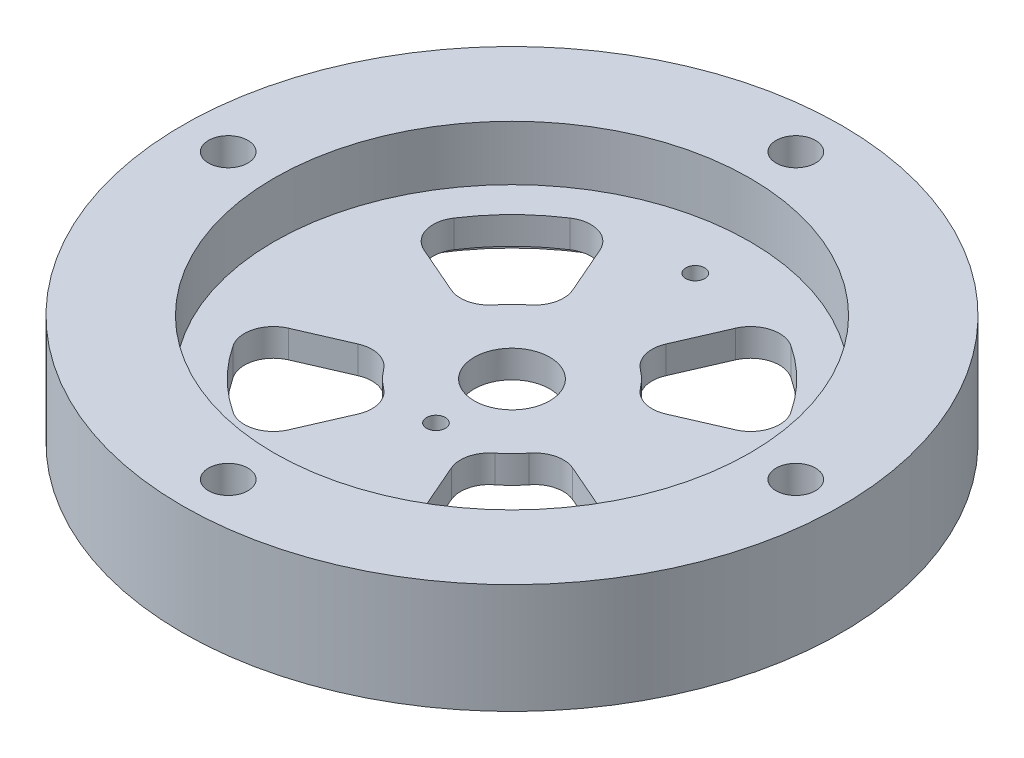
from build123d import *

# Parameters (mm, degrees)
CUT_EXTRUDE1_REACH                                = 53.264
F_18_0_1695_DIAMETER_HOLE1_D                      = 4.3053
F_18_0_1695_DIAMETER_HOLE1_DEPTH                  = 381
F_18_0_1695_DIAMETER_HOLE1_TIP                    = 1.293442612
CUT_EXTRUDE2_REACH                                = 53.264
SKETCH5_R                                         = 4.1275
CSK_FOR_1_FLAT_HEAD_MACHINE_SCREW_100_D           = 2.0574
CSK_FOR_1_FLAT_HEAD_MACHINE_SCREW_100_DEPTH       = 3
CSK_FOR_1_FLAT_HEAD_MACHINE_SCREW_100_CSINK_D     = 3.7084
CSK_FOR_1_FLAT_HEAD_MACHINE_SCREW_100_CSINK_ANGLE = 100
CSK_FOR_1_FLAT_HEAD_MACHINE_SCREW_100_TIP         = 0.618105319


with BuildPart() as part:
    # Sketch1 → Revolve1 (revolve)
    with BuildSketch(Plane.XY):
        Polygon((0, 3), (26, 3), (26, 0), (36, 0), (36, 12), (26, 12), (26, 6), (0, 6), align=None)
    revolve(axis=Axis((0, 0, 0), (0, 1, 0)))

    # Sketch2 → Cut-Extrude1 (cut, up to next)
    with BuildSketch(Plane(origin=(0, 6, 0), x_dir=(1, 0, 0), z_dir=(0, 1, 0)), mode=Mode.PRIVATE) as cut_extrude1_sk1:
        with BuildLine():
            Line((7.398917645, 17.016345603), (5.098689446, 11.726182923))
            ThreePointArc((5.098689446, 11.726182923), (4.936869827, 9.663717077), (6.079965983, 7.939396303))
            ThreePointArc((6.079965983, 7.939396303), (7.071067812, 7.071067812), (7.939396303, 6.079965983))
            ThreePointArc((7.939396303, 6.079965983), (9.663717077, 4.936869827), (11.726182923, 5.098689446))
            Line((11.726182923, 5.098689446), (17.016345603, 7.398917645))
            ThreePointArc((17.016345603, 7.398917645), (18.792276888, 9.401129193), (18.406745328, 12.049552955))
            ThreePointArc((18.406745328, 12.049552955), (15.556349186, 15.556349186), (12.049552955, 18.406745328))
            ThreePointArc((12.049552955, 18.406745328), (9.401129193, 18.792276888), (7.398917645, 17.016345603))
        make_face()
    cut_extrude1_tool1 = extrude(cut_extrude1_sk1.sketch, amount=-CUT_EXTRUDE1_REACH, mode=Mode.PRIVATE) & part.part
    # Sketch2 → Cut-Extrude1 (cut, up to next)
    with BuildSketch(Plane(origin=(0, 6, 0), x_dir=(1, 0, 0), z_dir=(0, 1, 0)), mode=Mode.PRIVATE) as cut_extrude1_sk2:
        with BuildLine():
            Line((-7.398917645, 17.016345603), (-5.098689446, 11.726182923))
            ThreePointArc((-5.098689446, 11.726182923), (-4.936869827, 9.663717077), (-6.079965983, 7.939396303))
            ThreePointArc((-6.079965983, 7.939396303), (-7.071067812, 7.071067812), (-7.939396303, 6.079965983))
            ThreePointArc((-7.939396303, 6.079965983), (-9.663717077, 4.936869827), (-11.726182923, 5.098689446))
            Line((-11.726182923, 5.098689446), (-17.016345603, 7.398917645))
            ThreePointArc((-17.016345603, 7.398917645), (-18.792276888, 9.401129193), (-18.406745328, 12.049552955))
            ThreePointArc((-18.406745328, 12.049552955), (-15.556349186, 15.556349186), (-12.049552955, 18.406745328))
            ThreePointArc((-12.049552955, 18.406745328), (-9.401129193, 18.792276888), (-7.398917645, 17.016345603))
        make_face()
    cut_extrude1_tool2 = extrude(cut_extrude1_sk2.sketch, amount=-CUT_EXTRUDE1_REACH, mode=Mode.PRIVATE) & part.part
    # Sketch2 → Cut-Extrude1 (cut, up to next)
    with BuildSketch(Plane(origin=(0, 6, 0), x_dir=(1, 0, 0), z_dir=(0, 1, 0)), mode=Mode.PRIVATE) as cut_extrude1_sk3:
        with BuildLine():
            Line((17.016345603, -7.398917645), (11.726182923, -5.098689446))
            ThreePointArc((11.726182923, -5.098689446), (9.663717077, -4.936869827), (7.939396303, -6.079965983))
            ThreePointArc((7.939396303, -6.079965983), (7.071067812, -7.071067812), (6.079965983, -7.939396303))
            ThreePointArc((6.079965983, -7.939396303), (4.936869827, -9.663717077), (5.098689446, -11.726182923))
            Line((5.098689446, -11.726182923), (7.398917645, -17.016345603))
            ThreePointArc((7.398917645, -17.016345603), (9.401129193, -18.792276888), (12.049552955, -18.406745328))
            ThreePointArc((12.049552955, -18.406745328), (15.556349186, -15.556349186), (18.406745328, -12.049552955))
            ThreePointArc((18.406745328, -12.049552955), (18.792276888, -9.401129193), (17.016345603, -7.398917645))
        make_face()
    cut_extrude1_tool3 = extrude(cut_extrude1_sk3.sketch, amount=-CUT_EXTRUDE1_REACH, mode=Mode.PRIVATE) & part.part
    # Sketch2 → Cut-Extrude1 (cut, up to next)
    with BuildSketch(Plane(origin=(0, 6, 0), x_dir=(1, 0, 0), z_dir=(0, 1, 0)), mode=Mode.PRIVATE) as cut_extrude1_sk4:
        with BuildLine():
            Line((-7.398917645, -17.016345603), (-5.098689446, -11.726182923))
            ThreePointArc((-5.098689446, -11.726182923), (-4.936869827, -9.663717077), (-6.079965983, -7.939396303))
            ThreePointArc((-6.079965983, -7.939396303), (-7.071067812, -7.071067812), (-7.939396303, -6.079965983))
            ThreePointArc((-7.939396303, -6.079965983), (-9.663717077, -4.936869827), (-11.726182923, -5.098689446))
            Line((-11.726182923, -5.098689446), (-17.016345603, -7.398917645))
            ThreePointArc((-17.016345603, -7.398917645), (-18.792276888, -9.401129193), (-18.406745328, -12.049552955))
            ThreePointArc((-18.406745328, -12.049552955), (-15.556349186, -15.556349186), (-12.049552955, -18.406745328))
            ThreePointArc((-12.049552955, -18.406745328), (-9.401129193, -18.792276888), (-7.398917645, -17.016345603))
        make_face()
    cut_extrude1_tool4 = extrude(cut_extrude1_sk4.sketch, amount=-CUT_EXTRUDE1_REACH, mode=Mode.PRIVATE) & part.part
    add(cut_extrude1_tool1.solids().sort_by_distance((11.555905, 6, -11.555905))[0], mode=Mode.SUBTRACT)
    add(cut_extrude1_tool2.solids().sort_by_distance((-11.555905, 6, -11.555905))[0], mode=Mode.SUBTRACT)
    add(cut_extrude1_tool3.solids().sort_by_distance((11.555905, 6, 11.555905))[0], mode=Mode.SUBTRACT)
    add(cut_extrude1_tool4.solids().sort_by_distance((-11.555905, 6, 11.555905))[0], mode=Mode.SUBTRACT)

    # #18 (0.1695) Diameter Hole1
    with Locations(Plane(origin=(0, 12, 0), x_dir=(1, 0, 0), z_dir=(0, 1, 0))):
        with Locations((0, 31), (0, -31), (-31, 0), (31, 0)):
            Hole(F_18_0_1695_DIAMETER_HOLE1_D / 2, depth=F_18_0_1695_DIAMETER_HOLE1_DEPTH)
            with Locations((0, 0, -(F_18_0_1695_DIAMETER_HOLE1_DEPTH + F_18_0_1695_DIAMETER_HOLE1_TIP / 2))):  # 118° drill point
                Cone(0, F_18_0_1695_DIAMETER_HOLE1_D / 2, F_18_0_1695_DIAMETER_HOLE1_TIP, mode=Mode.SUBTRACT)

    # Sketch5 → Cut-Extrude2 (cut, up to next)
    with BuildSketch(Plane(origin=(0, 6, 0), x_dir=(1, 0, 0), z_dir=(0, 1, 0)), mode=Mode.PRIVATE) as cut_extrude2_sk1:
        Circle(SKETCH5_R)
    cut_extrude2_tool1 = extrude(cut_extrude2_sk1.sketch, amount=-CUT_EXTRUDE2_REACH, mode=Mode.PRIVATE) & part.part
    add(cut_extrude2_tool1.solids().sort_by_distance((0, 6, 0))[0], mode=Mode.SUBTRACT)

    # CSK for #1 Flat Head Machine Screw (100)1
    with Locations(Plane(origin=(0, 3, 0), x_dir=(0, 0, -1), z_dir=(0, -1, 0))):
        with Locations((20.0152, 0), (-8.3058, 0)):
            CounterSinkHole(CSK_FOR_1_FLAT_HEAD_MACHINE_SCREW_100_D / 2, CSK_FOR_1_FLAT_HEAD_MACHINE_SCREW_100_CSINK_D / 2, depth=CSK_FOR_1_FLAT_HEAD_MACHINE_SCREW_100_DEPTH, counter_sink_angle=CSK_FOR_1_FLAT_HEAD_MACHINE_SCREW_100_CSINK_ANGLE)
            with Locations((0, 0, -(CSK_FOR_1_FLAT_HEAD_MACHINE_SCREW_100_DEPTH + CSK_FOR_1_FLAT_HEAD_MACHINE_SCREW_100_TIP / 2))):  # 118° drill point
                Cone(0, CSK_FOR_1_FLAT_HEAD_MACHINE_SCREW_100_D / 2, CSK_FOR_1_FLAT_HEAD_MACHINE_SCREW_100_TIP, mode=Mode.SUBTRACT)


solid = part.part
